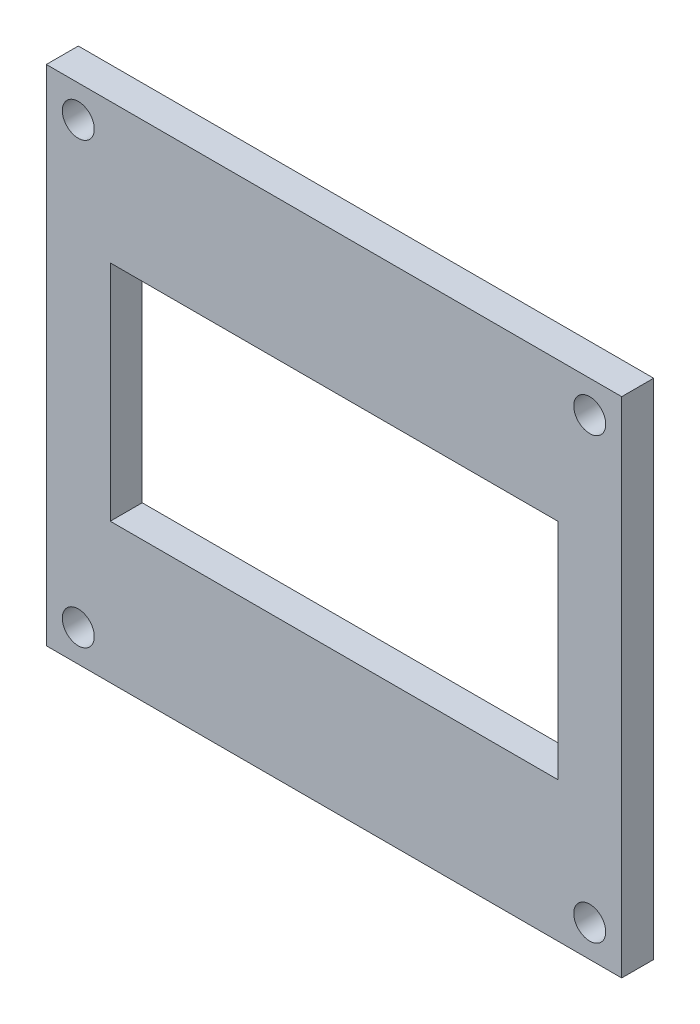
from build123d import *

# Parameters (mm, degrees)
SKETCH1_W           = 57.15
SKETCH1_H           = 50.00625
SKETCH1_W_2         = 44.45
SKETCH1_H_2         = 22.225
BOSS_EXTRUDE1_DEPTH = 3.175
SKETCH2_R           = 1.5875
CUT_EXTRUDE1_DEPTH  = 3.175


with BuildPart() as part:
    # Sketch1 → Boss-Extrude1 (new body)
    with BuildSketch(Plane.XY):
        Rectangle(SKETCH1_W, SKETCH1_H)
        Rectangle(SKETCH1_W_2, SKETCH1_H_2, mode=Mode.SUBTRACT)
    extrude(amount=BOSS_EXTRUDE1_DEPTH)

    # Sketch2 → Cut-Extrude1 (cut)
    with BuildSketch(Plane(origin=(0, 0, 0), x_dir=(-1, 0, 0), z_dir=(0, 0, -1))):
        with Locations((-25.4, -21.828125)):
            Circle(SKETCH2_R)
        with Locations((-25.4, 21.828125)):
            Circle(SKETCH2_R)
        with Locations((25.4, 21.828125)):
            Circle(SKETCH2_R)
        with Locations((25.4, -21.828125)):
            Circle(SKETCH2_R)
    extrude(amount=-CUT_EXTRUDE1_DEPTH, mode=Mode.SUBTRACT)


solid = part.part
